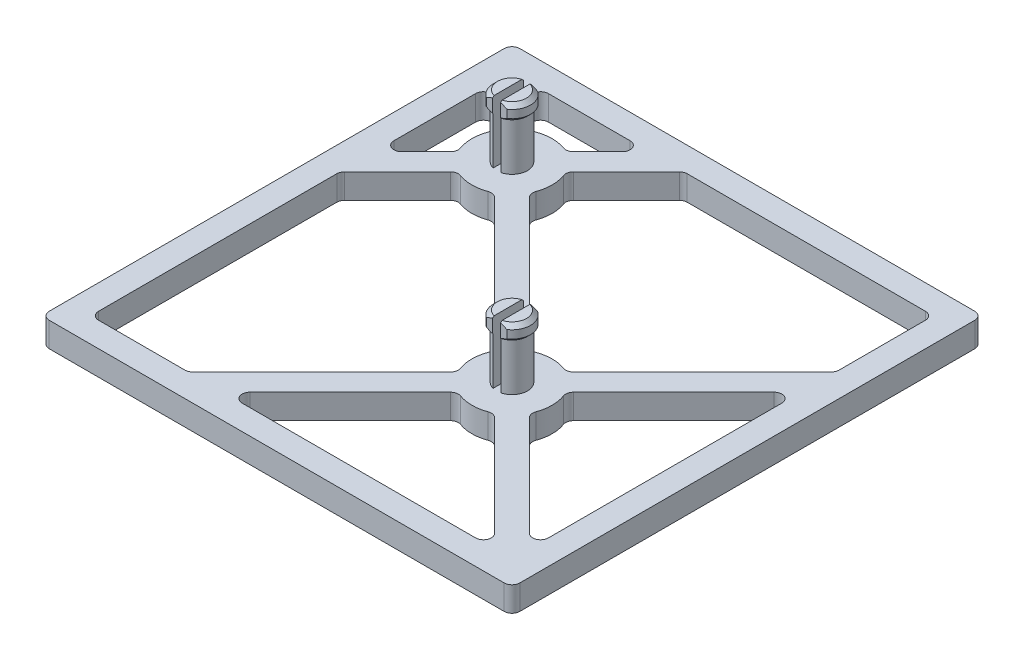
from build123d import *

# Parameters (mm, degrees)
BASE_PROFILE_W              = 76.2
BASE_PROFILE_H              = 76.2
BASE_DEPTH                  = 2
CONNECTOR_PROFILE_R         = 2.5
CONNECTOR_BODY_DEPTH        = 7.5
BASE_CUTOUT_DEPTH           = 4
BASE_FILLET_R               = 1.27
HEAD_PROFILE_R              = 3
CONNECTOR_HEAD_DEPTH        = 2.6
CONNECTOR_HEAD_CHAMFER_SIZE = 0.65
CONNECTOR_GAP_REACH         = 57.696
TRIM_START                  = -2.366882
TRIM_HEAD_DEPTH             = 2.133764


with BuildPart() as part:
    # Base Profile → Base (new, symmetric)
    with BuildSketch(Plane(origin=(0, 0, 0), x_dir=(1, 0, 0), z_dir=(0, 1, 0))):
        Rectangle(BASE_PROFILE_W, BASE_PROFILE_H)
    extrude(amount=BASE_DEPTH, both=True)

    # Connector Profile → Connector Body (add)
    with BuildSketch(Plane(origin=(0, 2, 0), x_dir=(1, 0, 0), z_dir=(0, 1, 0))):
        with Locations(Location((-21.59, 21.59, 0), (0, 0, 90))):
            Circle(CONNECTOR_PROFILE_R)
        with Locations(Location((9.302081056, -9.302081056, 0), (0, 0, 90))):
            Circle(CONNECTOR_PROFILE_R)
    extrude(amount=CONNECTOR_BODY_DEPTH)

    # Cutout Profile → Base Cutout (cut)
    with BuildSketch(Plane(origin=(0, 2, 0), x_dir=(1, 0, 0), z_dir=(0, 1, 0))):
        with BuildLine():
            Line((-31.271572875, 34.1), (-11.908427125, 34.1))
            Line((-11.908427125, 34.1), (-18.630999641, 27.377427484))
            ThreePointArc((-18.630999641, 27.377427484), (-21.59, 28.09), (-24.549000359, 27.377427484))
            Line((-24.549000359, 27.377427484), (-31.271572875, 34.1))
        make_face()
        with BuildLine():
            Line((-34.1, 31.271572875), (-34.1, 11.908427125))
            Line((-34.1, 11.908427125), (-27.377427484, 18.630999641))
            ThreePointArc((-27.377427484, 18.630999641), (-28.09, 21.59), (-27.377427484, 24.549000359))
            Line((-27.377427484, 24.549000359), (-34.1, 31.271572875))
        make_face()
        with BuildLine():
            Line((-34.1, -34.1), (-18.324265012, -34.1))
            Line((-18.324265012, -34.1), (3.514653573, -12.261081415))
            ThreePointArc((3.514653573, -12.261081415), (2.802081056, -9.302081056), (3.514653573, -6.343080698))
            Line((3.514653573, -6.343080698), (-18.630999641, 15.802572516))
            ThreePointArc((-18.630999641, 15.802572516), (-21.59, 15.09), (-24.549000359, 15.802572516))
            Line((-24.549000359, 15.802572516), (-34.1, 6.251572875))
            Line((-34.1, 6.251572875), (-34.1, -34.1))
        make_face()
        with BuildLine():
            Line((34.1, 34.1), (34.1, 18.324265012))
            Line((34.1, 18.324265012), (12.261081415, -3.514653573))
            ThreePointArc((12.261081415, -3.514653573), (9.302081056, -2.802081056), (6.343080698, -3.514653573))
            Line((6.343080698, -3.514653573), (-15.802572516, 18.630999641))
            ThreePointArc((-15.802572516, 18.630999641), (-15.09, 21.59), (-15.802572516, 24.549000359))
            Line((-15.802572516, 24.549000359), (-6.251572875, 34.1))
            Line((-6.251572875, 34.1), (34.1, 34.1))
        make_face()
        with BuildLine():
            Line((15.08950854, -6.343080698), (34.1, 12.667410762))
            Line((34.1, 12.667410762), (34.1, -31.271572875))
            Line((34.1, -31.271572875), (15.08950854, -12.261081415))
            ThreePointArc((15.08950854, -12.261081415), (15.802081056, -9.302081056), (15.08950854, -6.343080698))
        make_face()
        with BuildLine():
            Line((-12.667410762, -34.1), (6.343080698, -15.08950854))
            ThreePointArc((6.343080698, -15.08950854), (9.302081056, -15.802081056), (12.261081415, -15.08950854))
            Line((12.261081415, -15.08950854), (31.271572875, -34.1))
            Line((31.271572875, -34.1), (-12.667410762, -34.1))
        make_face()
    extrude(amount=-BASE_CUTOUT_DEPTH, mode=Mode.SUBTRACT)

    # Base Fillet
    base_fillet_edges = [part.edges().sort_by_distance(p)[0] for p in [
        (15.08950854, 0, 6.343080698),
        (15.08950854, 0, 12.261081415),
        (34.1, 0, 31.271572875),
        (34.1, 0, -12.667410762),
        (-18.630999641, 0, -27.377427484),
        (-11.908427125, 0, -34.1),
        (-31.271572875, 0, -34.1),
        (-24.549000359, 0, -27.377427484),
        (-34.1, 0, -31.271572875),
        (-34.1, 0, -11.908427125),
        (-27.377427484, 0, -18.630999641),
        (-27.377427484, 0, -24.549000359),
        (-18.324265012, 0, 34.1),
        (3.514653573, 0, 12.261081415),
        (3.514653573, 0, 6.343080698),
        (-18.630999641, 0, -15.802572516),
        (-24.549000359, 0, -15.802572516),
        (-34.1, 0, -6.251572875),
        (-34.1, 0, 34.1),
        (38.1, 0, 38.1),
        (6.343080698, 0, 15.08950854),
        (-12.667410762, 0, 34.1),
        (-38.1, 0, 38.1),
        (31.271572875, 0, 34.1),
        (12.261081415, 0, 15.08950854),
        (-38.1, 0, -38.1),
        (38.1, 0, -38.1),
        (6.343080698, 0, 3.514653573),
        (12.261081415, 0, 3.514653573),
        (34.1, 0, -18.324265012),
        (34.1, 0, -34.1),
        (-6.251572875, 0, -34.1),
        (-15.802572516, 0, -24.549000359),
        (-15.802572516, 0, -18.630999641),
    ]]
    fillet(base_fillet_edges, radius=BASE_FILLET_R)

    # Head Profile → Connector Head (add)
    with BuildSketch(Plane(origin=(0, 9.5, 0), x_dir=(1, 0, 0), z_dir=(0, 1, 0))):
        with Locations(Location((-21.59, 21.59, 0), (0, 0, 270))):
            Circle(HEAD_PROFILE_R)
        with Locations(Location((9.302081056, -9.302081056, 0), (0, 0, 270))):
            Circle(HEAD_PROFILE_R)
    extrude(amount=CONNECTOR_HEAD_DEPTH)

    # Connector Head Chamfer
    # the kernel refuses this chamfer: 0.65 mm, written as the material it takes off along each edge
    with BuildSketch(Plane(origin=(-21.59, 9.5, -21.59), x_dir=(0, 0, 1), z_dir=(-1, 0, 0))) as connector_head_chamfer_piece_1_section:
        Polygon((3, CONNECTOR_HEAD_CHAMFER_SIZE), (3 - CONNECTOR_HEAD_CHAMFER_SIZE, 0), (3, 0), align=None)
    connector_head_chamfer_piece_1 = revolve(axis=Axis((-21.59, 9.5, -21.59), (0, 1, 0)), mode=Mode.PRIVATE)
    connector_head_chamfer_piece_1 = connector_head_chamfer_piece_1 - Plane(origin=(-21.59, 9.898125366, -21.59), x_dir=(0, 0, -1), z_dir=(0, -1, 0)) * Cylinder(2.5, 12, mode=Mode.PRIVATE)
    add(connector_head_chamfer_piece_1, mode=Mode.SUBTRACT)
    with BuildSketch(Plane(origin=(-21.59, 12.1, -21.59), x_dir=(0, 0, 1), z_dir=(-1, 0, 0))) as connector_head_chamfer_piece_2:
        Polygon((3, -CONNECTOR_HEAD_CHAMFER_SIZE), (3 - CONNECTOR_HEAD_CHAMFER_SIZE, 0), (3, 0), align=None)
    revolve(axis=Axis((-21.59, 12.1, -21.59), (0, 1, 0)), mode=Mode.SUBTRACT)
    with BuildSketch(Plane(origin=(9.302081056, 9.5, 9.302081056), x_dir=(0, 0, 1), z_dir=(-1, 0, 0))) as connector_head_chamfer_piece_3_section:
        Polygon((3 - CONNECTOR_HEAD_CHAMFER_SIZE, 0), (3, CONNECTOR_HEAD_CHAMFER_SIZE), (3, 0), align=None)
    connector_head_chamfer_piece_3 = revolve(axis=Axis((9.302081056, 9.5, 9.302081056), (0, 1, 0)), mode=Mode.PRIVATE)
    connector_head_chamfer_piece_3 = connector_head_chamfer_piece_3 - Plane(origin=(9.302081056, 9.898125366, 9.302081056), x_dir=(0, 0, -1), z_dir=(0, -1, 0)) * Cylinder(2.5, 12, mode=Mode.PRIVATE)
    add(connector_head_chamfer_piece_3, mode=Mode.SUBTRACT)
    with BuildSketch(Plane(origin=(9.302081056, 12.1, 9.302081056), x_dir=(0, 0, 1), z_dir=(-1, 0, 0))) as connector_head_chamfer_piece_4:
        Polygon((3, -CONNECTOR_HEAD_CHAMFER_SIZE), (3 - CONNECTOR_HEAD_CHAMFER_SIZE, 0), (3, 0), align=None)
    revolve(axis=Axis((9.302081056, 12.1, 9.302081056), (0, 1, 0)), mode=Mode.SUBTRACT)

    # Connector Gap: up to this face of the body (flat: up to its plane)
    connector_gap_end = Plane(part.part.faces().sort_by_distance((-0.3212071, 2, -0.3212071))[0])
    # Gap Profile → Connector Gap (cut, up to the picked face)
    with BuildSketch(Plane(origin=(0, 12.1, 0), x_dir=(1, 0, 0), z_dir=(0, 1, 0)), mode=Mode.PRIVATE) as connector_gap_sk1:
        with BuildLine():
            Line((-22.24, 24.518736929), (-22.24, 18.661263071))
            ThreePointArc((-22.24, 18.661263071), (-21.59, 18.59), (-20.94, 18.661263071))
            Line((-20.94, 18.661263071), (-20.94, 24.518736929))
            ThreePointArc((-20.94, 24.518736929), (-21.59, 24.59), (-22.24, 24.518736929))
        make_face()
    connector_gap_tool1 = split(extrude(connector_gap_sk1.sketch, amount=-CONNECTOR_GAP_REACH, mode=Mode.PRIVATE), bisect_by=connector_gap_end, keep=Keep.BOTH, mode=Mode.PRIVATE)
    # Gap Profile → Connector Gap (cut, up to the picked face)
    with BuildSketch(Plane(origin=(0, 12.1, 0), x_dir=(1, 0, 0), z_dir=(0, 1, 0)), mode=Mode.PRIVATE) as connector_gap_sk2:
        with BuildLine():
            Line((8.652081056, -6.373344127), (8.652081056, -12.230817986))
            ThreePointArc((8.652081056, -12.230817986), (9.302081056, -12.302081056), (9.952081056, -12.230817986))
            Line((9.952081056, -12.230817986), (9.952081056, -6.373344127))
            ThreePointArc((9.952081056, -6.373344127), (9.302081056, -6.302081056), (8.652081056, -6.373344127))
        make_face()
    connector_gap_tool2 = split(extrude(connector_gap_sk2.sketch, amount=-CONNECTOR_GAP_REACH, mode=Mode.PRIVATE), bisect_by=connector_gap_end, keep=Keep.BOTH, mode=Mode.PRIVATE)
    add(connector_gap_tool1.solids().sort_by(Axis((-21.59, 12.1, -21.59), (0, -1, 0)))[0], mode=Mode.SUBTRACT)
    add(connector_gap_tool2.solids().sort_by(Axis((9.302081, 12.1, 9.302081), (0, -1, 0)))[0], mode=Mode.SUBTRACT)

    # Trim Profile → Trim Head (cut)
    with BuildSketch(Plane(origin=(0, 12.1, 0), x_dir=(1, 0, 0), z_dir=(0, 1, 0)).offset(TRIM_START)):
        with BuildLine():
            Line((7.643768661, -6.802081056), (10.960393452, -6.802081056))
            ThreePointArc((10.960393452, -6.802081056), (9.302081056, -6.302081056), (7.643768661, -6.802081056))
        make_face()
        with BuildLine():
            Line((7.643768661, -11.802081056), (10.960393452, -11.802081056))
            ThreePointArc((10.960393452, -11.802081056), (9.302081056, -12.302081056), (7.643768661, -11.802081056))
        make_face()
        with BuildLine():
            Line((-23.248312395, 24.09), (-19.931687605, 24.09))
            ThreePointArc((-19.931687605, 24.09), (-21.59, 24.59), (-23.248312395, 24.09))
        make_face()
        with BuildLine():
            Line((-23.248312395, 19.09), (-19.931687605, 19.09))
            ThreePointArc((-19.931687605, 19.09), (-21.59, 18.59), (-23.248312395, 19.09))
        make_face()
    extrude(amount=TRIM_HEAD_DEPTH, mode=Mode.SUBTRACT)


solid = part.part
